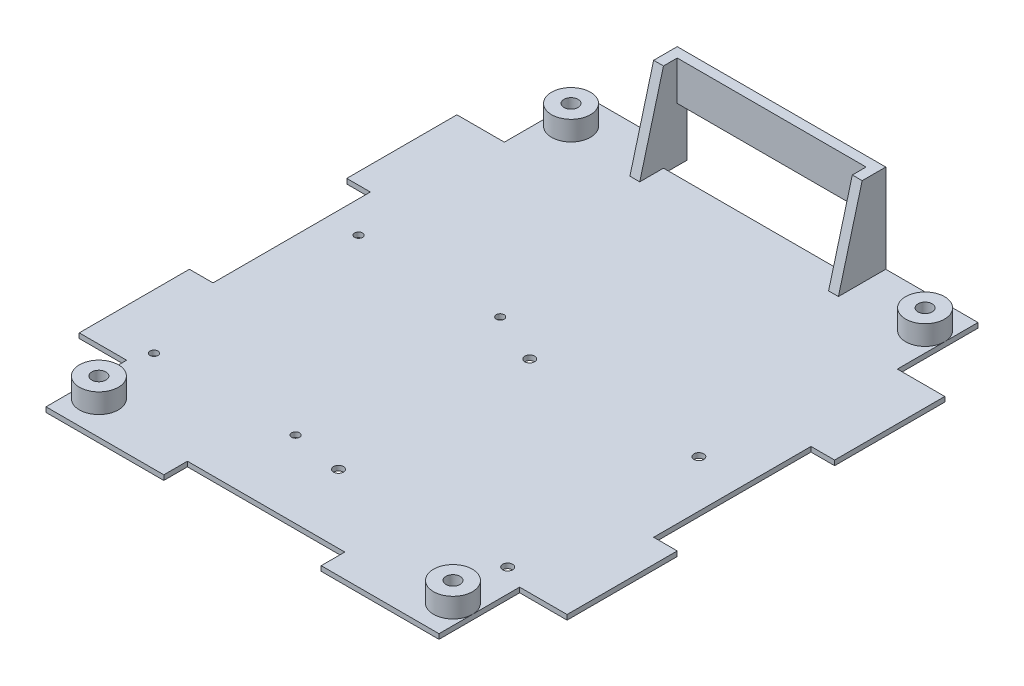
from build123d import *

# Parameters (mm, degrees)
SKETCH1_R           = 2.286
MAIN_BODY_DEPTH     = 1.5875
CUT_EXTRUDE2_REACH  = 119.348
SKETCH9_W           = 5.08
SKETCH9_H           = 7.62
SKETCH10_W          = 3.175
SKETCH10_H          = 7.62
BOSS_EXTRUDE6_DEPTH = 28.575
BOSS_EXTRUDE7_DEPTH = 3.175
SKETCH12_W          = 60.96
SKETCH12_H          = 12.7
BOSS_EXTRUDE8_DEPTH = 3.175
SKETCH13_R          = 6.28142
SKETCH13_R_2        = 2.286
BOSS_EXTRUDE9_DEPTH = 6.35
CUT_EXTRUDE3_REACH  = 122.767
SKETCH5_R           = 1.5875
SKETCH5_R_2         = 1.27


with BuildPart() as part:
    # Sketch1 → Main Body (new body)
    with BuildSketch(Plane(origin=(0, 0, 0), x_dir=(1, 0, 0), z_dir=(0, 1, 0))):
        Polygon((-25.4, 86.995), (-63.43142, 86.995), (-63.43142, 60.96), (-78.74, 60.96), (-78.74, 25.4), (-71.12, 25.4), (-71.12, -25.4), (-78.74, -25.4), (-78.74, -60.96), (-63.43142, -60.96), (-63.43142, -86.995), (-25.4, -86.995), (-25.4, -79.375), (25.4, -79.375), (25.4, -86.995), (63.43142, -86.995), (63.43142, -60.96), (78.74, -60.96), (78.74, -25.4), (71.12, -25.4), (71.12, 25.4), (78.74, 25.4), (78.74, 60.96), (63.43142, 60.96), (63.43142, 86.995), (25.4, 86.995), (25.4, 79.375), (-25.4, 79.375), align=None)
        with Locations((-57.15, 76.2)):
            Circle(SKETCH1_R, mode=Mode.SUBTRACT)
        with Locations((57.15, 76.2)):
            Circle(SKETCH1_R, mode=Mode.SUBTRACT)
        with Locations((57.15, -76.2)):
            Circle(SKETCH1_R, mode=Mode.SUBTRACT)
        with Locations((-57.15, -76.2)):
            Circle(SKETCH1_R, mode=Mode.SUBTRACT)
    extrude(amount=MAIN_BODY_DEPTH)

    # Sketch9 → Cut-Extrude2 (cut, up to next)
    with BuildSketch(Plane(origin=(0, 1.5875, 0), x_dir=(1, 0, 0), z_dir=(0, 1, 0)), mode=Mode.PRIVATE) as cut_extrude2_sk1:
        with Locations((27.94, 83.185)):
            Rectangle(SKETCH9_W, SKETCH9_H)
    cut_extrude2_tool1 = extrude(cut_extrude2_sk1.sketch, amount=-CUT_EXTRUDE2_REACH, mode=Mode.PRIVATE) & part.part
    # Sketch9 → Cut-Extrude2 (cut, up to next)
    with BuildSketch(Plane(origin=(0, 1.5875, 0), x_dir=(1, 0, 0), z_dir=(0, 1, 0)), mode=Mode.PRIVATE) as cut_extrude2_sk2:
        with Locations((-27.94, 83.185)):
            Rectangle(SKETCH9_W, SKETCH9_H)
    cut_extrude2_tool2 = extrude(cut_extrude2_sk2.sketch, amount=-CUT_EXTRUDE2_REACH, mode=Mode.PRIVATE) & part.part
    add(cut_extrude2_tool1.solids().sort_by_distance((27.94, 1.5875, -83.185))[0], mode=Mode.SUBTRACT)
    add(cut_extrude2_tool2.solids().sort_by_distance((-27.94, 1.5875, -83.185))[0], mode=Mode.SUBTRACT)

    # Sketch10 → Boss-Extrude6 (add)
    with BuildSketch(Plane(origin=(0, 1.5875, 0), x_dir=(1, 0, 0), z_dir=(0, 1, 0))):
        with Locations((32.0675, 83.185)):
            Rectangle(SKETCH10_W, SKETCH10_H)
        with Locations((-32.0675, 83.185)):
            Rectangle(SKETCH10_W, SKETCH10_H)
    extrude(amount=BOSS_EXTRUDE6_DEPTH)

    # Sketch11 → Boss-Extrude7 (add)
    with BuildSketch(Plane(origin=(33.655, 0, 0), x_dir=(0, 0, -1), z_dir=(1, 0, 0))):
        Polygon((79.375, 1.5875), (79.375, 30.1625), (71.718351826, 1.5875), align=None)
    boss_extrude7 = extrude(amount=-BOSS_EXTRUDE7_DEPTH)

    # Mirror2: Boss-Extrude7 across plane
    add(boss_extrude7.mirror(Plane(origin=(0, 0, 0), x_dir=(0, 0, 1), z_dir=(1, 0, 0))))

    # Sketch12 → Boss-Extrude8 (add)
    with BuildSketch(Plane(origin=(0, 0, -86.995), x_dir=(-1, 0, 0), z_dir=(0, 0, -1))):
        with Locations((0, 23.8125)):
            Rectangle(SKETCH12_W, SKETCH12_H)
    extrude(amount=-BOSS_EXTRUDE8_DEPTH)

    # Sketch13 → Boss-Extrude9 (add)
    # profile 1 of 4: a face of its own
    with BuildSketch(Plane(origin=(0, 1.5875, 0), x_dir=(1, 0, 0), z_dir=(0, 1, 0))):
        with Locations((-57.15, 76.2)):
            Circle(SKETCH13_R)
        with Locations((-57.15, 76.2)):
            Circle(SKETCH13_R_2, mode=Mode.SUBTRACT)
    # profile 2 of 4: a face of its own
    with BuildSketch(Plane(origin=(0, 1.5875, 0), x_dir=(1, 0, 0), z_dir=(0, 1, 0))):
        with Locations((-57.15, -76.2)):
            Circle(SKETCH13_R)
        with Locations((-57.15, -76.2)):
            Circle(SKETCH13_R_2, mode=Mode.SUBTRACT)
    # profile 3 of 4: a face of its own
    with BuildSketch(Plane(origin=(0, 1.5875, 0), x_dir=(1, 0, 0), z_dir=(0, 1, 0))):
        with Locations((57.15, -76.2)):
            Circle(SKETCH13_R)
        with Locations((57.15, -76.2)):
            Circle(SKETCH13_R_2, mode=Mode.SUBTRACT)
    # profile 4 of 4: a face of its own
    with BuildSketch(Plane(origin=(0, 1.5875, 0), x_dir=(1, 0, 0), z_dir=(0, 1, 0))):
        with Locations((57.15, 76.2)):
            Circle(SKETCH13_R)
        with Locations((57.15, 76.2)):
            Circle(SKETCH13_R_2, mode=Mode.SUBTRACT)
    extrude(amount=BOSS_EXTRUDE9_DEPTH)

    # Sketch5 → Cut-Extrude3 (cut, up to next)
    with BuildSketch(Plane(origin=(0, 1.5875, 0), x_dir=(1, 0, 0), z_dir=(0, 1, 0)), mode=Mode.PRIVATE) as cut_extrude3_sk1:
        with Locations((1.27, 4.445)):
            Circle(SKETCH5_R)
    cut_extrude3_tool1 = extrude(cut_extrude3_sk1.sketch, amount=-CUT_EXTRUDE3_REACH, mode=Mode.PRIVATE) & part.part
    # Sketch5 → Cut-Extrude3 (cut, up to next)
    with BuildSketch(Plane(origin=(0, 1.5875, 0), x_dir=(1, 0, 0), z_dir=(0, 1, 0)), mode=Mode.PRIVATE) as cut_extrude3_sk2:
        with Locations((55.88, 4.445)):
            Circle(SKETCH5_R)
    cut_extrude3_tool2 = extrude(cut_extrude3_sk2.sketch, amount=-CUT_EXTRUDE3_REACH, mode=Mode.PRIVATE) & part.part
    # Sketch5 → Cut-Extrude3 (cut, up to next)
    with BuildSketch(Plane(origin=(0, 1.5875, 0), x_dir=(1, 0, 0), z_dir=(0, 1, 0)), mode=Mode.PRIVATE) as cut_extrude3_sk3:
        with Locations((55.88, -57.277)):
            Circle(SKETCH5_R)
    cut_extrude3_tool3 = extrude(cut_extrude3_sk3.sketch, amount=-CUT_EXTRUDE3_REACH, mode=Mode.PRIVATE) & part.part
    # Sketch5 → Cut-Extrude3 (cut, up to next)
    with BuildSketch(Plane(origin=(0, 1.5875, 0), x_dir=(1, 0, 0), z_dir=(0, 1, 0)), mode=Mode.PRIVATE) as cut_extrude3_sk4:
        with Locations((1.27, -57.277)):
            Circle(SKETCH5_R)
    cut_extrude3_tool4 = extrude(cut_extrude3_sk4.sketch, amount=-CUT_EXTRUDE3_REACH, mode=Mode.PRIVATE) & part.part
    # Sketch5 → Cut-Extrude3 (cut, up to next)
    with BuildSketch(Plane(origin=(0, 1.5875, 0), x_dir=(1, 0, 0), z_dir=(0, 1, 0)), mode=Mode.PRIVATE) as cut_extrude3_sk5:
        with Locations((-15.24, -54.61)):
            Circle(SKETCH5_R_2)
    cut_extrude3_tool5 = extrude(cut_extrude3_sk5.sketch, amount=-CUT_EXTRUDE3_REACH, mode=Mode.PRIVATE) & part.part
    # Sketch5 → Cut-Extrude3 (cut, up to next)
    with BuildSketch(Plane(origin=(0, 1.5875, 0), x_dir=(1, 0, 0), z_dir=(0, 1, 0)), mode=Mode.PRIVATE) as cut_extrude3_sk6:
        with Locations((-60.96, -54.61)):
            Circle(SKETCH5_R_2)
    cut_extrude3_tool6 = extrude(cut_extrude3_sk6.sketch, amount=-CUT_EXTRUDE3_REACH, mode=Mode.PRIVATE) & part.part
    # Sketch5 → Cut-Extrude3 (cut, up to next)
    with BuildSketch(Plane(origin=(0, 1.5875, 0), x_dir=(1, 0, 0), z_dir=(0, 1, 0)), mode=Mode.PRIVATE) as cut_extrude3_sk7:
        with Locations((-60.96, 11.43)):
            Circle(SKETCH5_R_2)
    cut_extrude3_tool7 = extrude(cut_extrude3_sk7.sketch, amount=-CUT_EXTRUDE3_REACH, mode=Mode.PRIVATE) & part.part
    # Sketch5 → Cut-Extrude3 (cut, up to next)
    with BuildSketch(Plane(origin=(0, 1.5875, 0), x_dir=(1, 0, 0), z_dir=(0, 1, 0)), mode=Mode.PRIVATE) as cut_extrude3_sk8:
        with Locations((-15.24, 11.43)):
            Circle(SKETCH5_R_2)
    cut_extrude3_tool8 = extrude(cut_extrude3_sk8.sketch, amount=-CUT_EXTRUDE3_REACH, mode=Mode.PRIVATE) & part.part
    add(cut_extrude3_tool1.solids().sort_by_distance((1.27, 1.5875, -4.445))[0], mode=Mode.SUBTRACT)
    add(cut_extrude3_tool2.solids().sort_by_distance((55.88, 1.5875, -4.445))[0], mode=Mode.SUBTRACT)
    add(cut_extrude3_tool3.solids().sort_by_distance((55.88, 1.5875, 57.277))[0], mode=Mode.SUBTRACT)
    add(cut_extrude3_tool4.solids().sort_by_distance((1.27, 1.5875, 57.277))[0], mode=Mode.SUBTRACT)
    add(cut_extrude3_tool5.solids().sort_by_distance((-15.24, 1.5875, 54.61))[0], mode=Mode.SUBTRACT)
    add(cut_extrude3_tool6.solids().sort_by_distance((-60.96, 1.5875, 54.61))[0], mode=Mode.SUBTRACT)
    add(cut_extrude3_tool7.solids().sort_by_distance((-60.96, 1.5875, -11.43))[0], mode=Mode.SUBTRACT)
    add(cut_extrude3_tool8.solids().sort_by_distance((-15.24, 1.5875, -11.43))[0], mode=Mode.SUBTRACT)


solid = part.part
